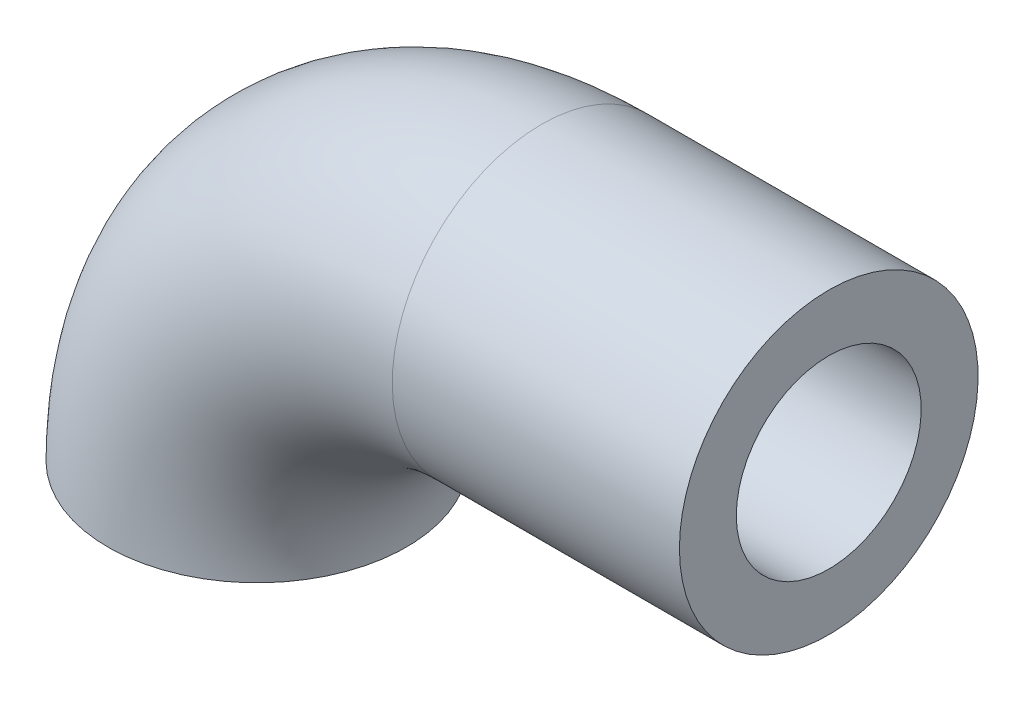
from build123d import *

# Parameters (mm, degrees)
SKETCH2_R   = 5.25
SKETCH2_R_2 = 3.25


with BuildPart() as part:
    # Sweep1: sweep along a path in Sketch1
    with BuildLine(Plane.XY) as sweep1_path:
        Line((20.094853238, 10), (10, 10))
        ThreePointArc((10, 10), (2.928932188, 7.071067812), (0, 0))
    # Sketch2 → Sweep1 (sweep)
    with BuildSketch(Plane(origin=(0, 0, 0), x_dir=(1, 0, 0), z_dir=(0, 1, 0))):
        Circle(SKETCH2_R)
        Circle(SKETCH2_R_2, mode=Mode.SUBTRACT)
    sweep(path=sweep1_path.line)


solid = part.part
